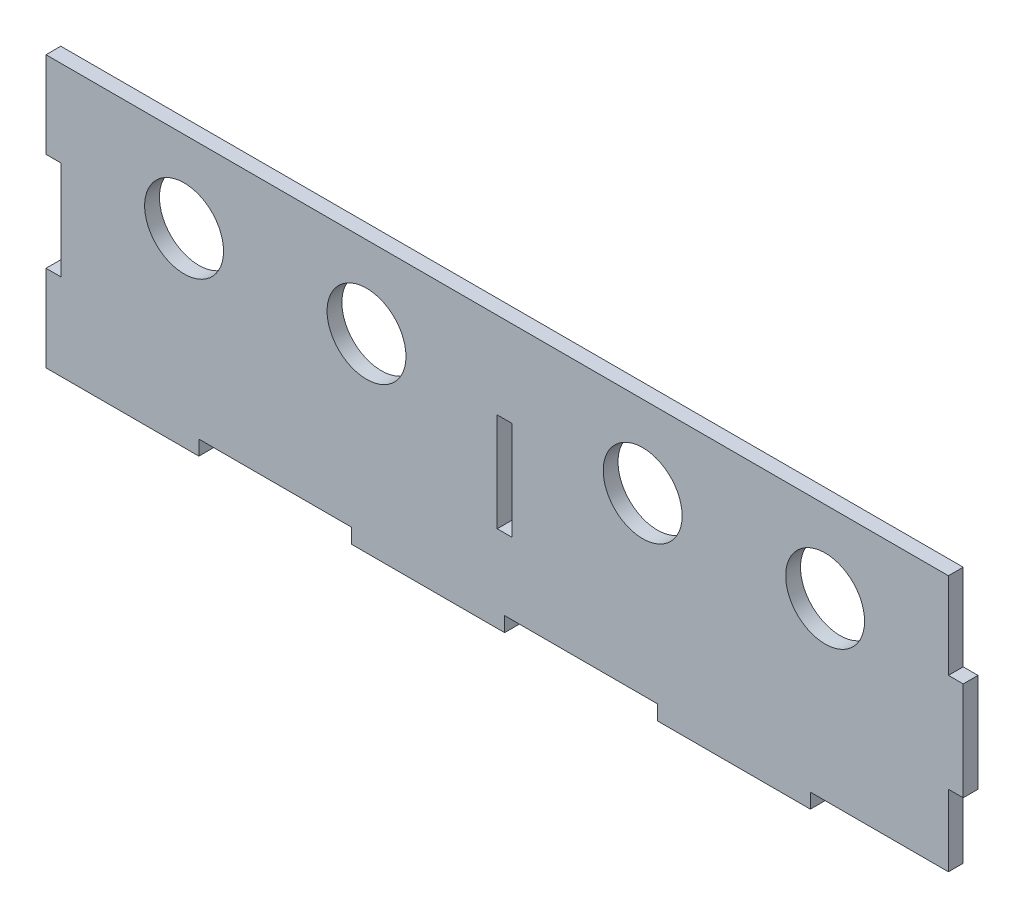
from build123d import *

# Parameters (mm, degrees)
SKETCH1_R           = 8
SKETCH1_W           = 3
SKETCH1_H           = 20
BOSS_EXTRUDE1_DEPTH = 3


with BuildPart() as part:
    # Sketch1 → Boss-Extrude1 (new body)
    with BuildSketch(Plane.XY):
        Polygon((-93, 27.5), (-93, 10), (-90, 10), (-90, -10), (-93, -10), (-93, -27.5), (-62, -27.5), (-62, -24.5), (-31, -24.5), (-31, -27.5), (0, -27.5), (0, -24.5), (31, -24.5), (31, -27.5), (62, -27.5), (62, -24.5), (90, -24.5), (90, -10), (93, -10), (93, 10), (90, 10), (90, 27.5), (0, 27.5), align=None)
        with Locations((-65, 11)):
            Circle(SKETCH1_R, mode=Mode.SUBTRACT)
        Rectangle(SKETCH1_W, SKETCH1_H, mode=Mode.SUBTRACT)
        with Locations((-28, 11)):
            Circle(SKETCH1_R, mode=Mode.SUBTRACT)
        with Locations((28, 11)):
            Circle(SKETCH1_R, mode=Mode.SUBTRACT)
        with Locations((65, 11)):
            Circle(SKETCH1_R, mode=Mode.SUBTRACT)
    extrude(amount=BOSS_EXTRUDE1_DEPTH)


solid = part.part
